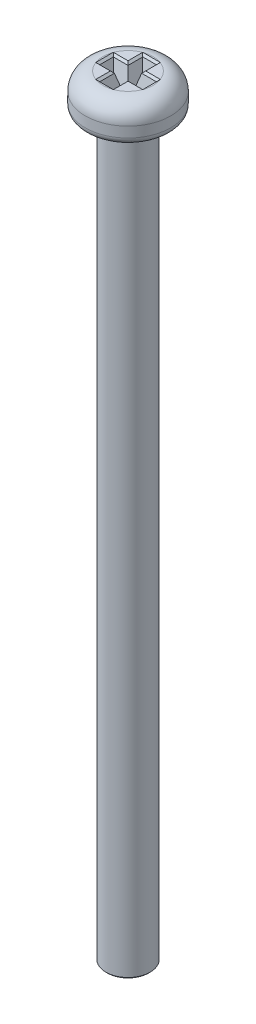
from build123d import *

# Parameters (mm, degrees)
FILLET_1_R          = 1.2
FILLET_2_R          = 0.5
CUT_EXTRUDE_1_DEPTH = 1.5
CUT_EXTRUDE_1_DRAFT = -15
CHAMFER_1_SIZE      = 0.1
CHAMFER_1_SIZE_2    = 0.141421356
CHAMFER_2_SIZE      = 0.1


with BuildPart() as part:
    # Эскиз1 → Повернуть1 (revolve)
    with BuildSketch(Plane.XY, mode=Mode.PRIVATE) as revolve_1_sk:
        Polygon((2.9, 52.4), (2.9, 50), (1.5, 50), (1.5, 0), (0, 0), (0, 52.4), align=None)
    revolve(revolve_1_sk.sketch.rotate(Axis((0, 0, 0), (0, 1, 0)), 90), axis=Axis((0, 0, 0), (0, 1, 0)))

    # Скругление1
    fillet_1_edges = [part.edges().sort_by_distance(p)[0] for p in [
        (0, 52.4, 2.9),
    ]]
    fillet(fillet_1_edges, radius=FILLET_1_R)

    # Скругление2
    fillet_2_edges = [part.edges().sort_by_distance(p)[0] for p in [
        (0, 50, 2.9),
    ]]
    fillet(fillet_2_edges, radius=FILLET_2_R)


with BuildPart() as cut_extrude_1_tool:
    # Эскиз2 → Вырез-Вытянуть1 (with draft: the straight prism first)
    with BuildSketch(Plane(origin=(0, 52.4, 0), x_dir=(1, 0, 0), z_dir=(0, 1, 0))):
        Polygon((0.5, -0.5), (1.5, -0.5), (1.5, 0.5), (0.5, 0.5), (0.5, 1.5), (-0.5, 1.5), (-0.5, 0.5), (-1.5, 0.5), (-1.5, -0.5), (-0.5, -0.5), (-0.5, -1.5), (0.5, -1.5), align=None)
    extrude(amount=-CUT_EXTRUDE_1_DEPTH)
    # Вырез-Вытянуть1: the draft: its side faces are tilted about the plane it starts from
    cut_extrude_1_sides = [cut_extrude_1_tool.faces().sort_by_distance(p)[0] for p in [
        (1, 51.65, 0.5),
        (1.5, 51.65, 0),
        (1, 51.65, -0.5),
        (0.5, 51.65, -1),
        (0, 51.65, -1.5),
        (-0.5, 51.65, -1),
        (-1, 51.65, -0.5),
        (-1.5, 51.65, 0),
        (-1, 51.65, 0.5),
        (-0.5, 51.65, 1),
        (0, 51.65, 1.5),
        (0.5, 51.65, 1),
    ]]
    draft(cut_extrude_1_sides, Plane(origin=(0, 52.4, 0), x_dir=(1, 0, 0), z_dir=(0, 1, 0)), CUT_EXTRUDE_1_DRAFT)


with BuildPart() as part_1:
    add(part.part)

    # Вырез-Вытянуть1: cut by cut_extrude_1_tool
    add(cut_extrude_1_tool.part, mode=Mode.SUBTRACT)

    # Фаска1
    # the kernel refuses this chamfer: 0.141421356, 0.1 mm, written as the material it takes off along each edge
    with BuildSketch(Plane(origin=(-1.865869176, 52.4, 0.5), x_dir=(0, 0.03843312210118317, 0.999261174631315), z_dir=(1, 0, 0))) as chamfer_1_piece_1_section:
        Polygon((CHAMFER_1_SIZE * 0.999261174631, CHAMFER_1_SIZE * 0.0384331221012), (-CHAMFER_1_SIZE_2 * 0.295751368745, CHAMFER_1_SIZE_2 * 0.955264953425), (0, 0), align=None)
    chamfer_1_piece_1 = extrude(amount=1.731738352, mode=Mode.PRIVATE)
    chamfer_1_piece_1 = split(chamfer_1_piece_1, bisect_by=Plane(origin=(-1.442553631, 52.185607233, 0.520378905), z_dir=(0.9659258262890681, 0.25881904510252135, 0)), keep=Keep.TOP, mode=Mode.PRIVATE)
    add(chamfer_1_piece_1, mode=Mode.SUBTRACT)
    with BuildSketch(Plane(origin=(-0.5, 52.4, 0.134130824), x_dir=(-0.999261174631315, 0.03843312210118317, 0), z_dir=(0, 0, 1))) as chamfer_1_piece_2_section:
        Polygon((CHAMFER_1_SIZE * 0.999261174631, CHAMFER_1_SIZE * 0.0384331221012), (-CHAMFER_1_SIZE_2 * 0.295751368745, CHAMFER_1_SIZE_2 * 0.955264953425), (0, 0), align=None)
    chamfer_1_piece_2 = extrude(amount=1.731738352, mode=Mode.PRIVATE)
    chamfer_1_piece_2 = split(chamfer_1_piece_2, bisect_by=Plane(origin=(-0.520378905, 52.185607233, 1.442553631), z_dir=(0, 0.2588190451025214, -0.9659258262890683)), keep=Keep.TOP, mode=Mode.PRIVATE)
    add(chamfer_1_piece_2, mode=Mode.SUBTRACT)
    with BuildSketch(Plane(origin=(-0.865869176, 52.4, 1.5), x_dir=(0, 0.03843312210118309, 0.999261174631315), z_dir=(1, 0, 0))) as chamfer_1_piece_3_section:
        Polygon((CHAMFER_1_SIZE * 0.999261174631, CHAMFER_1_SIZE * 0.0384331221012), (-CHAMFER_1_SIZE_2 * 0.295751368745, CHAMFER_1_SIZE_2 * 0.955264953425), (0, 0), align=None)
    chamfer_1_piece_3 = extrude(amount=1.731738352, mode=Mode.PRIVATE)
    chamfer_1_piece_3 = split(chamfer_1_piece_3, bisect_by=Plane(origin=(0.455319395, 52.233249713, 1.520658938), z_dir=(-0.9659258262890681, 0.25881904510252135, 0)), keep=Keep.TOP, mode=Mode.PRIVATE)
    chamfer_1_piece_3 = split(chamfer_1_piece_3, bisect_by=Plane(origin=(-0.455319395, 52.233249713, 1.520658938), z_dir=(0.9659258262890681, 0.25881904510252135, 0)), keep=Keep.TOP, mode=Mode.PRIVATE)
    add(chamfer_1_piece_3, mode=Mode.SUBTRACT)
    with BuildSketch(Plane(origin=(0.5, 52.4, 1.865869176), x_dir=(0.999261174631315, 0.03843312210118317, 0), z_dir=(0, 0, -1))) as chamfer_1_piece_4_section:
        Polygon((CHAMFER_1_SIZE * 0.999261174631, CHAMFER_1_SIZE * 0.0384331221012), (-CHAMFER_1_SIZE_2 * 0.295751368745, CHAMFER_1_SIZE_2 * 0.955264953425), (0, 0), align=None)
    chamfer_1_piece_4 = extrude(amount=1.731738352, mode=Mode.PRIVATE)
    chamfer_1_piece_4 = split(chamfer_1_piece_4, bisect_by=Plane(origin=(0.520378905, 52.185607233, 1.442553631), z_dir=(0, 0.2588190451025214, -0.9659258262890683)), keep=Keep.TOP, mode=Mode.PRIVATE)
    add(chamfer_1_piece_4, mode=Mode.SUBTRACT)
    with BuildSketch(Plane(origin=(0.134130824, 52.4, 0.5), x_dir=(0, 0.03843312210118317, 0.999261174631315), z_dir=(1, 0, 0))) as chamfer_1_piece_5_section:
        Polygon((CHAMFER_1_SIZE * 0.999261174631, CHAMFER_1_SIZE * 0.0384331221012), (-CHAMFER_1_SIZE_2 * 0.295751368745, CHAMFER_1_SIZE_2 * 0.955264953425), (0, 0), align=None)
    chamfer_1_piece_5 = extrude(amount=1.731738352, mode=Mode.PRIVATE)
    chamfer_1_piece_5 = split(chamfer_1_piece_5, bisect_by=Plane(origin=(1.442553631, 52.185607233, 0.520378905), z_dir=(-0.9659258262890681, 0.25881904510252135, 0)), keep=Keep.TOP, mode=Mode.PRIVATE)
    add(chamfer_1_piece_5, mode=Mode.SUBTRACT)
    with BuildSketch(Plane(origin=(1.5, 52.4, 0.865869176), x_dir=(0.999261174631315, 0.03843312210118309, 0), z_dir=(0, 0, -1))) as chamfer_1_piece_6_section:
        Polygon((CHAMFER_1_SIZE * 0.999261174631, CHAMFER_1_SIZE * 0.0384331221012), (-CHAMFER_1_SIZE_2 * 0.295751368745, CHAMFER_1_SIZE_2 * 0.955264953425), (0, 0), align=None)
    chamfer_1_piece_6 = extrude(amount=1.731738352, mode=Mode.PRIVATE)
    chamfer_1_piece_6 = split(chamfer_1_piece_6, bisect_by=Plane(origin=(1.520658938, 52.233249713, -0.455319395), z_dir=(0, 0.2588190451025214, 0.9659258262890683)), keep=Keep.TOP, mode=Mode.PRIVATE)
    chamfer_1_piece_6 = split(chamfer_1_piece_6, bisect_by=Plane(origin=(1.520658938, 52.233249713, 0.455319395), z_dir=(0, 0.2588190451025214, -0.9659258262890683)), keep=Keep.TOP, mode=Mode.PRIVATE)
    add(chamfer_1_piece_6, mode=Mode.SUBTRACT)
    with BuildSketch(Plane(origin=(1.865869176, 52.4, -0.5), x_dir=(0, 0.03843312210118317, -0.999261174631315), z_dir=(-1, 0, 0))) as chamfer_1_piece_7_section:
        Polygon((CHAMFER_1_SIZE * 0.999261174631, CHAMFER_1_SIZE * 0.0384331221012), (-CHAMFER_1_SIZE_2 * 0.295751368745, CHAMFER_1_SIZE_2 * 0.955264953425), (0, 0), align=None)
    chamfer_1_piece_7 = extrude(amount=1.731738352, mode=Mode.PRIVATE)
    chamfer_1_piece_7 = split(chamfer_1_piece_7, bisect_by=Plane(origin=(1.442553631, 52.185607233, -0.520378905), z_dir=(-0.9659258262890681, 0.25881904510252135, 0)), keep=Keep.TOP, mode=Mode.PRIVATE)
    add(chamfer_1_piece_7, mode=Mode.SUBTRACT)
    with BuildSketch(Plane(origin=(0.5, 52.4, -0.134130824), x_dir=(0.999261174631315, 0.03843312210118317, 0), z_dir=(0, 0, -1))) as chamfer_1_piece_8_section:
        Polygon((CHAMFER_1_SIZE * 0.999261174631, CHAMFER_1_SIZE * 0.0384331221012), (-CHAMFER_1_SIZE_2 * 0.295751368745, CHAMFER_1_SIZE_2 * 0.955264953425), (0, 0), align=None)
    chamfer_1_piece_8 = extrude(amount=1.731738352, mode=Mode.PRIVATE)
    chamfer_1_piece_8 = split(chamfer_1_piece_8, bisect_by=Plane(origin=(0.520378905, 52.185607233, -1.442553631), z_dir=(0, 0.2588190451025214, 0.9659258262890683)), keep=Keep.TOP, mode=Mode.PRIVATE)
    add(chamfer_1_piece_8, mode=Mode.SUBTRACT)
    with BuildSketch(Plane(origin=(0.865869176, 52.4, -1.5), x_dir=(0, 0.03843312210118309, -0.999261174631315), z_dir=(-1, 0, 0))) as chamfer_1_piece_9_section:
        Polygon((CHAMFER_1_SIZE * 0.999261174631, CHAMFER_1_SIZE * 0.0384331221012), (-CHAMFER_1_SIZE_2 * 0.295751368745, CHAMFER_1_SIZE_2 * 0.955264953425), (0, 0), align=None)
    chamfer_1_piece_9 = extrude(amount=1.731738352, mode=Mode.PRIVATE)
    chamfer_1_piece_9 = split(chamfer_1_piece_9, bisect_by=Plane(origin=(-0.455319395, 52.233249713, -1.520658938), z_dir=(0.9659258262890681, 0.25881904510252135, 0)), keep=Keep.TOP, mode=Mode.PRIVATE)
    chamfer_1_piece_9 = split(chamfer_1_piece_9, bisect_by=Plane(origin=(0.455319395, 52.233249713, -1.520658938), z_dir=(-0.9659258262890681, 0.25881904510252135, 0)), keep=Keep.TOP, mode=Mode.PRIVATE)
    add(chamfer_1_piece_9, mode=Mode.SUBTRACT)
    with BuildSketch(Plane(origin=(-0.5, 52.4, -1.865869176), x_dir=(-0.999261174631315, 0.03843312210118317, 0), z_dir=(0, 0, 1))) as chamfer_1_piece_10_section:
        Polygon((CHAMFER_1_SIZE * 0.999261174631, CHAMFER_1_SIZE * 0.0384331221012), (-CHAMFER_1_SIZE_2 * 0.295751368745, CHAMFER_1_SIZE_2 * 0.955264953425), (0, 0), align=None)
    chamfer_1_piece_10 = extrude(amount=1.731738352, mode=Mode.PRIVATE)
    chamfer_1_piece_10 = split(chamfer_1_piece_10, bisect_by=Plane(origin=(-0.520378905, 52.185607233, -1.442553631), z_dir=(0, 0.2588190451025214, 0.9659258262890683)), keep=Keep.TOP, mode=Mode.PRIVATE)
    add(chamfer_1_piece_10, mode=Mode.SUBTRACT)
    with BuildSketch(Plane(origin=(-1.5, 52.4, -0.865869176), x_dir=(-0.999261174631315, 0.03843312210118309, 0), z_dir=(0, 0, 1))) as chamfer_1_piece_11_section:
        Polygon((CHAMFER_1_SIZE * 0.999261174631, CHAMFER_1_SIZE * 0.0384331221012), (-CHAMFER_1_SIZE_2 * 0.295751368745, CHAMFER_1_SIZE_2 * 0.955264953425), (0, 0), align=None)
    chamfer_1_piece_11 = extrude(amount=1.731738352, mode=Mode.PRIVATE)
    chamfer_1_piece_11 = split(chamfer_1_piece_11, bisect_by=Plane(origin=(-1.520658938, 52.233249713, 0.455319395), z_dir=(0, 0.2588190451025214, -0.9659258262890683)), keep=Keep.TOP, mode=Mode.PRIVATE)
    chamfer_1_piece_11 = split(chamfer_1_piece_11, bisect_by=Plane(origin=(-1.520658938, 52.233249713, -0.455319395), z_dir=(0, 0.2588190451025214, 0.9659258262890683)), keep=Keep.TOP, mode=Mode.PRIVATE)
    add(chamfer_1_piece_11, mode=Mode.SUBTRACT)
    with BuildSketch(Plane(origin=(-0.134130824, 52.4, -0.5), x_dir=(0, 0.03843312210118317, -0.999261174631315), z_dir=(-1, 0, 0))) as chamfer_1_piece_12_section:
        Polygon((CHAMFER_1_SIZE * 0.999261174631, CHAMFER_1_SIZE * 0.0384331221012), (-CHAMFER_1_SIZE_2 * 0.295751368745, CHAMFER_1_SIZE_2 * 0.955264953425), (0, 0), align=None)
    chamfer_1_piece_12 = extrude(amount=1.731738352, mode=Mode.PRIVATE)
    chamfer_1_piece_12 = split(chamfer_1_piece_12, bisect_by=Plane(origin=(-1.442553631, 52.185607233, -0.520378905), z_dir=(0.9659258262890681, 0.25881904510252135, 0)), keep=Keep.TOP, mode=Mode.PRIVATE)
    add(chamfer_1_piece_12, mode=Mode.SUBTRACT)
    with BuildSketch(Plane(origin=(-1.865869176, 52.4, 0.5), x_dir=(0, 0.03843312210118317, 0.999261174631315), z_dir=(1, 0, 0))) as chamfer_1_piece_13a_section:
        Polygon((CHAMFER_1_SIZE * 0.999261174631, CHAMFER_1_SIZE * 0.0384331221012), (-CHAMFER_1_SIZE_2 * 0.295751368745, CHAMFER_1_SIZE_2 * 0.955264953425), (0, 0), align=None)
    chamfer_1_piece_13a = extrude(amount=1.731738352, mode=Mode.PRIVATE)
    chamfer_1_piece_13a = split(chamfer_1_piece_13a, bisect_by=Plane(origin=(-1.50027229, 52.401016202, 0.519656174), z_dir=(-0.9659258262890681, -0.25881904510252135, 0)), keep=Keep.TOP, mode=Mode.PRIVATE)
    with BuildSketch(Plane(origin=(-1.5, 52.4, -0.865869176), x_dir=(-0.999261174631315, 0.03843312210118309, 0), z_dir=(0, 0, 1))) as chamfer_1_piece_13b_section:
        Polygon((CHAMFER_1_SIZE * 0.999261174631, CHAMFER_1_SIZE * 0.0384331221012), (-CHAMFER_1_SIZE_2 * 0.295751368745, CHAMFER_1_SIZE_2 * 0.955264953425), (0, 0), align=None)
    chamfer_1_piece_13b = extrude(amount=1.731738352, mode=Mode.PRIVATE)
    chamfer_1_piece_13b = split(chamfer_1_piece_13b, bisect_by=Plane(origin=(-1.519656174, 52.401016202, 0.50027229), z_dir=(0, -0.2588190451025214, 0.9659258262890683)), keep=Keep.TOP, mode=Mode.PRIVATE)
    chamfer_1_piece_13 = chamfer_1_piece_13a & chamfer_1_piece_13b
    add(chamfer_1_piece_13, mode=Mode.SUBTRACT)
    with BuildSketch(Plane(origin=(-0.865869176, 52.4, 1.5), x_dir=(0, 0.03843312210118309, 0.999261174631315), z_dir=(1, 0, 0))) as chamfer_1_piece_14a_section:
        Polygon((CHAMFER_1_SIZE * 0.999261174631, CHAMFER_1_SIZE * 0.0384331221012), (-CHAMFER_1_SIZE_2 * 0.295751368745, CHAMFER_1_SIZE_2 * 0.955264953425), (0, 0), align=None)
    chamfer_1_piece_14a = extrude(amount=1.731738352, mode=Mode.PRIVATE)
    chamfer_1_piece_14a = split(chamfer_1_piece_14a, bisect_by=Plane(origin=(-0.50027229, 52.401016202, 1.519656174), z_dir=(-0.9659258262890681, -0.25881904510252135, 0)), keep=Keep.TOP, mode=Mode.PRIVATE)
    with BuildSketch(Plane(origin=(-0.5, 52.4, 0.134130824), x_dir=(-0.999261174631315, 0.03843312210118317, 0), z_dir=(0, 0, 1))) as chamfer_1_piece_14b_section:
        Polygon((CHAMFER_1_SIZE * 0.999261174631, CHAMFER_1_SIZE * 0.0384331221012), (-CHAMFER_1_SIZE_2 * 0.295751368745, CHAMFER_1_SIZE_2 * 0.955264953425), (0, 0), align=None)
    chamfer_1_piece_14b = extrude(amount=1.731738352, mode=Mode.PRIVATE)
    chamfer_1_piece_14b = split(chamfer_1_piece_14b, bisect_by=Plane(origin=(-0.519656174, 52.401016202, 1.50027229), z_dir=(0, -0.2588190451025214, 0.9659258262890683)), keep=Keep.TOP, mode=Mode.PRIVATE)
    chamfer_1_piece_14 = chamfer_1_piece_14a & chamfer_1_piece_14b
    add(chamfer_1_piece_14, mode=Mode.SUBTRACT)
    with BuildSketch(Plane(origin=(0.5, 52.4, 1.865869176), x_dir=(0.999261174631315, 0.03843312210118317, 0), z_dir=(0, 0, -1))) as chamfer_1_piece_15a_section:
        Polygon((CHAMFER_1_SIZE * 0.999261174631, CHAMFER_1_SIZE * 0.0384331221012), (-CHAMFER_1_SIZE_2 * 0.295751368745, CHAMFER_1_SIZE_2 * 0.955264953425), (0, 0), align=None)
    chamfer_1_piece_15a = extrude(amount=1.731738352, mode=Mode.PRIVATE)
    chamfer_1_piece_15a = split(chamfer_1_piece_15a, bisect_by=Plane(origin=(0.519656174, 52.401016202, 1.50027229), z_dir=(0, -0.2588190451025214, 0.9659258262890683)), keep=Keep.TOP, mode=Mode.PRIVATE)
    with BuildSketch(Plane(origin=(-0.865869176, 52.4, 1.5), x_dir=(0, 0.03843312210118309, 0.999261174631315), z_dir=(1, 0, 0))) as chamfer_1_piece_15b_section:
        Polygon((CHAMFER_1_SIZE * 0.999261174631, CHAMFER_1_SIZE * 0.0384331221012), (-CHAMFER_1_SIZE_2 * 0.295751368745, CHAMFER_1_SIZE_2 * 0.955264953425), (0, 0), align=None)
    chamfer_1_piece_15b = extrude(amount=1.731738352, mode=Mode.PRIVATE)
    chamfer_1_piece_15b = split(chamfer_1_piece_15b, bisect_by=Plane(origin=(0.50027229, 52.401016202, 1.519656174), z_dir=(0.9659258262890681, -0.25881904510252135, 0)), keep=Keep.TOP, mode=Mode.PRIVATE)
    chamfer_1_piece_15 = chamfer_1_piece_15a & chamfer_1_piece_15b
    add(chamfer_1_piece_15, mode=Mode.SUBTRACT)
    with BuildSketch(Plane(origin=(1.5, 52.4, 0.865869176), x_dir=(0.999261174631315, 0.03843312210118309, 0), z_dir=(0, 0, -1))) as chamfer_1_piece_16a_section:
        Polygon((CHAMFER_1_SIZE * 0.999261174631, CHAMFER_1_SIZE * 0.0384331221012), (-CHAMFER_1_SIZE_2 * 0.295751368745, CHAMFER_1_SIZE_2 * 0.955264953425), (0, 0), align=None)
    chamfer_1_piece_16a = extrude(amount=1.731738352, mode=Mode.PRIVATE)
    chamfer_1_piece_16a = split(chamfer_1_piece_16a, bisect_by=Plane(origin=(1.519656174, 52.401016202, 0.50027229), z_dir=(0, -0.2588190451025214, 0.9659258262890683)), keep=Keep.TOP, mode=Mode.PRIVATE)
    with BuildSketch(Plane(origin=(0.134130824, 52.4, 0.5), x_dir=(0, 0.03843312210118317, 0.999261174631315), z_dir=(1, 0, 0))) as chamfer_1_piece_16b_section:
        Polygon((CHAMFER_1_SIZE * 0.999261174631, CHAMFER_1_SIZE * 0.0384331221012), (-CHAMFER_1_SIZE_2 * 0.295751368745, CHAMFER_1_SIZE_2 * 0.955264953425), (0, 0), align=None)
    chamfer_1_piece_16b = extrude(amount=1.731738352, mode=Mode.PRIVATE)
    chamfer_1_piece_16b = split(chamfer_1_piece_16b, bisect_by=Plane(origin=(1.50027229, 52.401016202, 0.519656174), z_dir=(0.9659258262890681, -0.25881904510252135, 0)), keep=Keep.TOP, mode=Mode.PRIVATE)
    chamfer_1_piece_16 = chamfer_1_piece_16a & chamfer_1_piece_16b
    add(chamfer_1_piece_16, mode=Mode.SUBTRACT)
    with BuildSketch(Plane(origin=(1.865869176, 52.4, -0.5), x_dir=(0, 0.03843312210118317, -0.999261174631315), z_dir=(-1, 0, 0))) as chamfer_1_piece_17a_section:
        Polygon((CHAMFER_1_SIZE * 0.999261174631, CHAMFER_1_SIZE * 0.0384331221012), (-CHAMFER_1_SIZE_2 * 0.295751368745, CHAMFER_1_SIZE_2 * 0.955264953425), (0, 0), align=None)
    chamfer_1_piece_17a = extrude(amount=1.731738352, mode=Mode.PRIVATE)
    chamfer_1_piece_17a = split(chamfer_1_piece_17a, bisect_by=Plane(origin=(1.50027229, 52.401016202, -0.519656174), z_dir=(0.9659258262890681, -0.25881904510252135, 0)), keep=Keep.TOP, mode=Mode.PRIVATE)
    with BuildSketch(Plane(origin=(1.5, 52.4, 0.865869176), x_dir=(0.999261174631315, 0.03843312210118309, 0), z_dir=(0, 0, -1))) as chamfer_1_piece_17b_section:
        Polygon((CHAMFER_1_SIZE * 0.999261174631, CHAMFER_1_SIZE * 0.0384331221012), (-CHAMFER_1_SIZE_2 * 0.295751368745, CHAMFER_1_SIZE_2 * 0.955264953425), (0, 0), align=None)
    chamfer_1_piece_17b = extrude(amount=1.731738352, mode=Mode.PRIVATE)
    chamfer_1_piece_17b = split(chamfer_1_piece_17b, bisect_by=Plane(origin=(1.519656174, 52.401016202, -0.50027229), z_dir=(0, -0.2588190451025214, -0.9659258262890683)), keep=Keep.TOP, mode=Mode.PRIVATE)
    chamfer_1_piece_17 = chamfer_1_piece_17a & chamfer_1_piece_17b
    add(chamfer_1_piece_17, mode=Mode.SUBTRACT)
    with BuildSketch(Plane(origin=(0.865869176, 52.4, -1.5), x_dir=(0, 0.03843312210118309, -0.999261174631315), z_dir=(-1, 0, 0))) as chamfer_1_piece_18a_section:
        Polygon((CHAMFER_1_SIZE * 0.999261174631, CHAMFER_1_SIZE * 0.0384331221012), (-CHAMFER_1_SIZE_2 * 0.295751368745, CHAMFER_1_SIZE_2 * 0.955264953425), (0, 0), align=None)
    chamfer_1_piece_18a = extrude(amount=1.731738352, mode=Mode.PRIVATE)
    chamfer_1_piece_18a = split(chamfer_1_piece_18a, bisect_by=Plane(origin=(0.50027229, 52.401016202, -1.519656174), z_dir=(0.9659258262890681, -0.25881904510252135, 0)), keep=Keep.TOP, mode=Mode.PRIVATE)
    with BuildSketch(Plane(origin=(0.5, 52.4, -0.134130824), x_dir=(0.999261174631315, 0.03843312210118317, 0), z_dir=(0, 0, -1))) as chamfer_1_piece_18b_section:
        Polygon((CHAMFER_1_SIZE * 0.999261174631, CHAMFER_1_SIZE * 0.0384331221012), (-CHAMFER_1_SIZE_2 * 0.295751368745, CHAMFER_1_SIZE_2 * 0.955264953425), (0, 0), align=None)
    chamfer_1_piece_18b = extrude(amount=1.731738352, mode=Mode.PRIVATE)
    chamfer_1_piece_18b = split(chamfer_1_piece_18b, bisect_by=Plane(origin=(0.519656174, 52.401016202, -1.50027229), z_dir=(0, -0.2588190451025214, -0.9659258262890683)), keep=Keep.TOP, mode=Mode.PRIVATE)
    chamfer_1_piece_18 = chamfer_1_piece_18a & chamfer_1_piece_18b
    add(chamfer_1_piece_18, mode=Mode.SUBTRACT)
    with BuildSketch(Plane(origin=(-0.5, 52.4, -1.865869176), x_dir=(-0.999261174631315, 0.03843312210118317, 0), z_dir=(0, 0, 1))) as chamfer_1_piece_19a_section:
        Polygon((CHAMFER_1_SIZE * 0.999261174631, CHAMFER_1_SIZE * 0.0384331221012), (-CHAMFER_1_SIZE_2 * 0.295751368745, CHAMFER_1_SIZE_2 * 0.955264953425), (0, 0), align=None)
    chamfer_1_piece_19a = extrude(amount=1.731738352, mode=Mode.PRIVATE)
    chamfer_1_piece_19a = split(chamfer_1_piece_19a, bisect_by=Plane(origin=(-0.519656174, 52.401016202, -1.50027229), z_dir=(0, -0.2588190451025214, -0.9659258262890683)), keep=Keep.TOP, mode=Mode.PRIVATE)
    with BuildSketch(Plane(origin=(0.865869176, 52.4, -1.5), x_dir=(0, 0.03843312210118309, -0.999261174631315), z_dir=(-1, 0, 0))) as chamfer_1_piece_19b_section:
        Polygon((CHAMFER_1_SIZE * 0.999261174631, CHAMFER_1_SIZE * 0.0384331221012), (-CHAMFER_1_SIZE_2 * 0.295751368745, CHAMFER_1_SIZE_2 * 0.955264953425), (0, 0), align=None)
    chamfer_1_piece_19b = extrude(amount=1.731738352, mode=Mode.PRIVATE)
    chamfer_1_piece_19b = split(chamfer_1_piece_19b, bisect_by=Plane(origin=(-0.50027229, 52.401016202, -1.519656174), z_dir=(-0.9659258262890681, -0.25881904510252135, 0)), keep=Keep.TOP, mode=Mode.PRIVATE)
    chamfer_1_piece_19 = chamfer_1_piece_19a & chamfer_1_piece_19b
    add(chamfer_1_piece_19, mode=Mode.SUBTRACT)
    with BuildSketch(Plane(origin=(-1.5, 52.4, -0.865869176), x_dir=(-0.999261174631315, 0.03843312210118309, 0), z_dir=(0, 0, 1))) as chamfer_1_piece_20a_section:
        Polygon((CHAMFER_1_SIZE * 0.999261174631, CHAMFER_1_SIZE * 0.0384331221012), (-CHAMFER_1_SIZE_2 * 0.295751368745, CHAMFER_1_SIZE_2 * 0.955264953425), (0, 0), align=None)
    chamfer_1_piece_20a = extrude(amount=1.731738352, mode=Mode.PRIVATE)
    chamfer_1_piece_20a = split(chamfer_1_piece_20a, bisect_by=Plane(origin=(-1.519656174, 52.401016202, -0.50027229), z_dir=(0, -0.2588190451025214, -0.9659258262890683)), keep=Keep.TOP, mode=Mode.PRIVATE)
    with BuildSketch(Plane(origin=(-0.134130824, 52.4, -0.5), x_dir=(0, 0.03843312210118317, -0.999261174631315), z_dir=(-1, 0, 0))) as chamfer_1_piece_20b_section:
        Polygon((CHAMFER_1_SIZE * 0.999261174631, CHAMFER_1_SIZE * 0.0384331221012), (-CHAMFER_1_SIZE_2 * 0.295751368745, CHAMFER_1_SIZE_2 * 0.955264953425), (0, 0), align=None)
    chamfer_1_piece_20b = extrude(amount=1.731738352, mode=Mode.PRIVATE)
    chamfer_1_piece_20b = split(chamfer_1_piece_20b, bisect_by=Plane(origin=(-1.50027229, 52.401016202, -0.519656174), z_dir=(-0.9659258262890681, -0.25881904510252135, 0)), keep=Keep.TOP, mode=Mode.PRIVATE)
    chamfer_1_piece_20 = chamfer_1_piece_20a & chamfer_1_piece_20b
    add(chamfer_1_piece_20, mode=Mode.SUBTRACT)

    # Фаска2
    chamfer_2_edges = [part_1.edges().sort_by_distance(p)[0] for p in [
        (0, 0, 1.5),
    ]]
    chamfer(chamfer_2_edges, length=CHAMFER_2_SIZE)


solid = part_1.part
